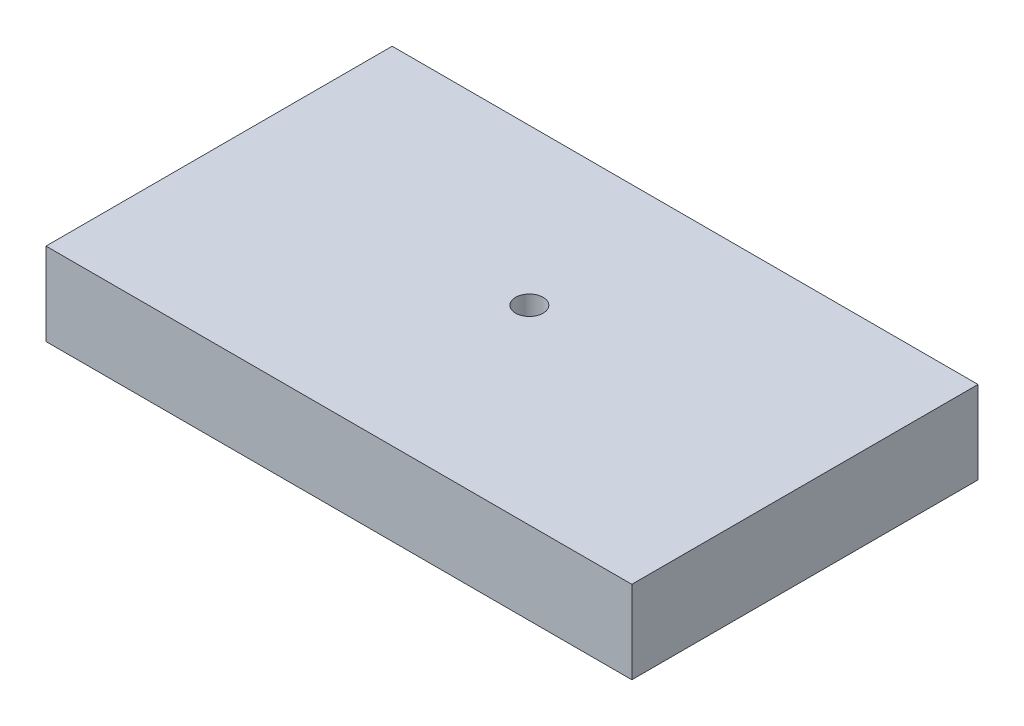
from build123d import *

# Parameters (mm, degrees)
SKETCH1_W           = 42.5
SKETCH1_H           = 25.112566395
SKETCH1_R           = 1
BOSS_EXTRUDE1_DEPTH = 3
BOSS_EXTRUDE2_DEPTH = 3


with BuildPart() as part:
    # Sketch1 → Boss-Extrude1 (new body)
    with BuildSketch(Plane(origin=(0, 0, 0), x_dir=(1, 0, 0), z_dir=(0, 1, 0))):
        with Locations((0, 12.556283198)):
            Rectangle(SKETCH1_W, SKETCH1_H)
        with Locations((0, 13.812566395)):
            Circle(SKETCH1_R, mode=Mode.SUBTRACT)
    extrude(amount=BOSS_EXTRUDE1_DEPTH)

    # Sketch1<3> → Boss-Extrude2 (add)
    with BuildSketch(Plane(origin=(0, 0, 0), x_dir=(1, 0, 0), z_dir=(0, 1, 0))):
        with BuildLine():
            ThreePointArc((10.5, 19.112566395), (0, 8.612566395), (-10.5, 19.112566395))
            Line((-10.5, 19.112566395), (-10.5, 25.112566395))
            Line((-10.5, 25.112566395), (-21.25, 25.112566395))
            Line((-21.25, 25.112566395), (-21.25, 0))
            Line((-21.25, 0), (21.25, 0))
            Line((21.25, 0), (21.25, 25.112566395))
            Line((21.25, 25.112566395), (10.5, 25.112566395))
            Line((10.5, 25.112566395), (10.5, 19.112566395))
        make_face()
    extrude(amount=-BOSS_EXTRUDE2_DEPTH)


solid = part.part
